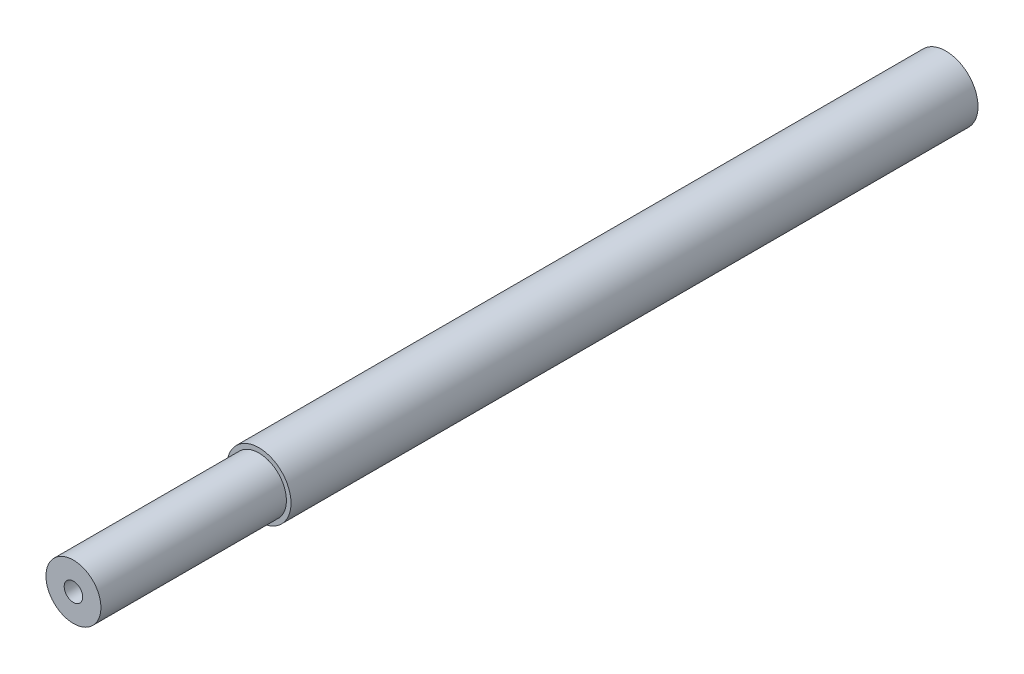
from build123d import *

# Parameters (mm, degrees)
SKETCH2_R          = 2.0193
CUT_EXTRUDE1_DEPTH = 25


with BuildPart() as part:
    # Sketch1 → Revolve1 (revolve)
    with BuildSketch(Plane(origin=(0, 0, 0), x_dir=(0, 0, -1), z_dir=(1, 0, 0))):
        Polygon((183, 0), (183, 7), (33, 7), (33, 6), (-7.5, 6), (-7.5, 0), align=None)
    revolve(axis=Axis((0, 0, 0), (0, 0, -1)))

    # Sketch2 → Cut-Extrude1 (cut)
    with BuildSketch(Plane.XY.offset(7.5)):
        Circle(SKETCH2_R)
    extrude(amount=-CUT_EXTRUDE1_DEPTH, mode=Mode.SUBTRACT)


solid = part.part
